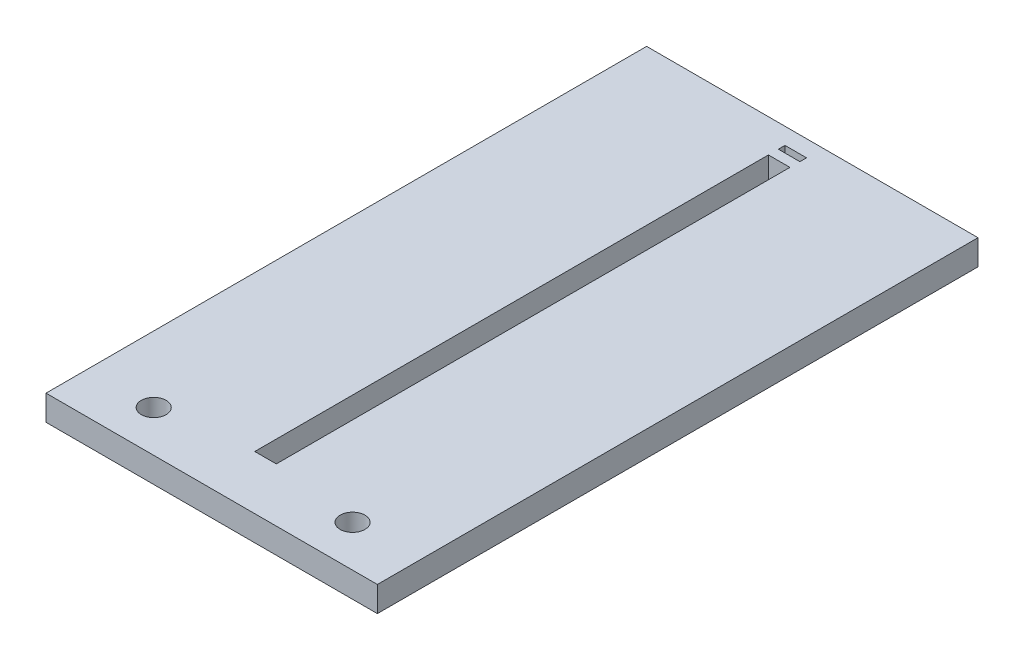
from build123d import *

# Parameters (mm, degrees)
SKETCH1_W           = 40
SKETCH1_H           = 72.5
BOSS_EXTRUDE1_DEPTH = 3.05
SKETCH4_W           = 2.6
SKETCH4_H           = 0.8
SKETCH4_H_2         = 62
CUT_EXTRUDE1_DEPTH  = 76.269864488
SKETCH7_R           = 1.5
CUT_EXTRUDE4_DEPTH  = 76.269864488


with BuildPart() as part:
    # Sketch1 → Boss-Extrude1 (new body)
    with BuildSketch(Plane(origin=(0, 0, 0), x_dir=(1, 0, 0), z_dir=(0, 1, 0))):
        with Locations((0, 36.25)):
            Rectangle(SKETCH1_W, SKETCH1_H)
    extrude(amount=BOSS_EXTRUDE1_DEPTH)

    # Sketch4 → Cut-Extrude1 (cut, through all)
    with BuildSketch(Plane(origin=(0, 3.05, 0), x_dir=(1, 0, 0), z_dir=(0, 1, 0))):
        with Locations((0, 70.1)):
            Rectangle(SKETCH4_W, SKETCH4_H)
        with Locations((0, 37.5)):
            Rectangle(SKETCH4_W, SKETCH4_H_2)
    extrude(amount=-CUT_EXTRUDE1_DEPTH, mode=Mode.SUBTRACT)

    # Sketch7 → Cut-Extrude4 (cut, through all)
    with BuildSketch(Plane(origin=(0, 3.05, 0), x_dir=(1, 0, 0), z_dir=(0, 1, 0))):
        with Locations((-12, 5)):
            Circle(SKETCH7_R)
        with Locations((12, 5)):
            Circle(SKETCH7_R)
    extrude(amount=-CUT_EXTRUDE4_DEPTH, mode=Mode.SUBTRACT)


solid = part.part
